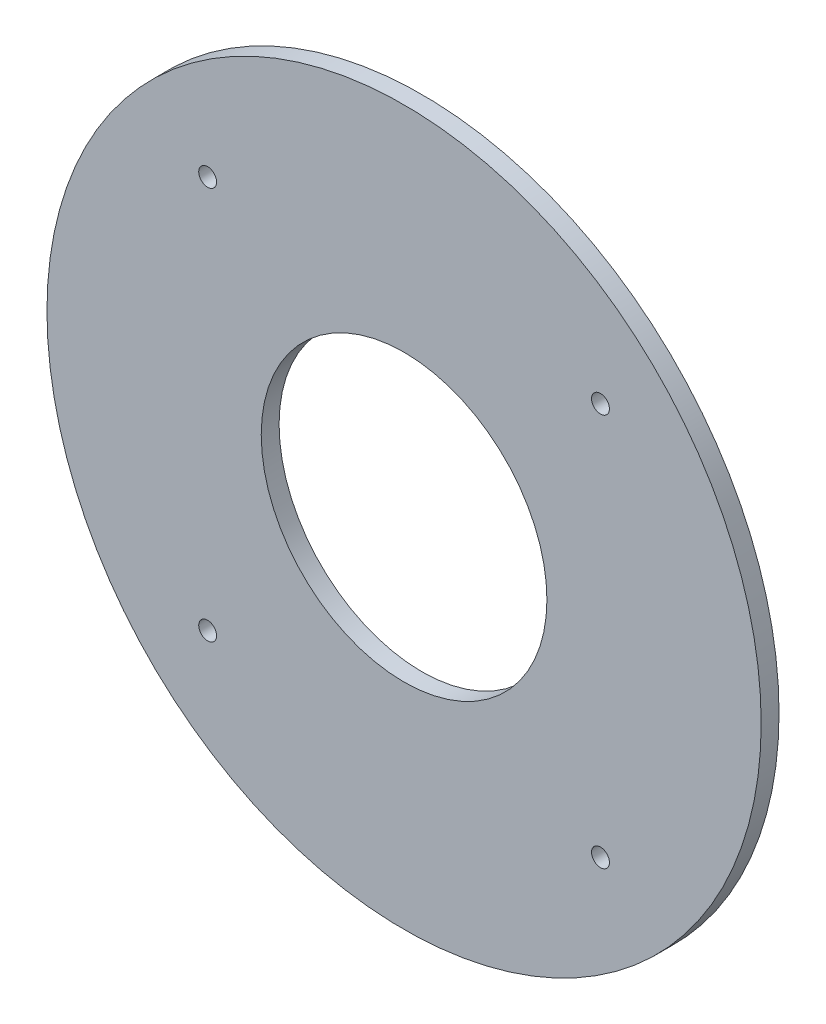
from build123d import *

# Parameters (mm, degrees)
SKETCH1_R           = 127
SKETCH1_R_2         = 50.8
SKETCH1_R_3         = 3.175
BOSS_EXTRUDE1_DEPTH = 6.35


with BuildPart() as part:
    # Sketch1 → Boss-Extrude1 (new body)
    with BuildSketch(Plane.XY):
        Circle(SKETCH1_R)
        Circle(SKETCH1_R_2, mode=Mode.SUBTRACT)
        with Locations((-69.85, 69.85)):
            Circle(SKETCH1_R_3, mode=Mode.SUBTRACT)
        with Locations((69.85, 69.85)):
            Circle(SKETCH1_R_3, mode=Mode.SUBTRACT)
        with Locations((-69.85, -69.85)):
            Circle(SKETCH1_R_3, mode=Mode.SUBTRACT)
        with Locations((69.85, -69.85)):
            Circle(SKETCH1_R_3, mode=Mode.SUBTRACT)
    extrude(amount=BOSS_EXTRUDE1_DEPTH)


solid = part.part
